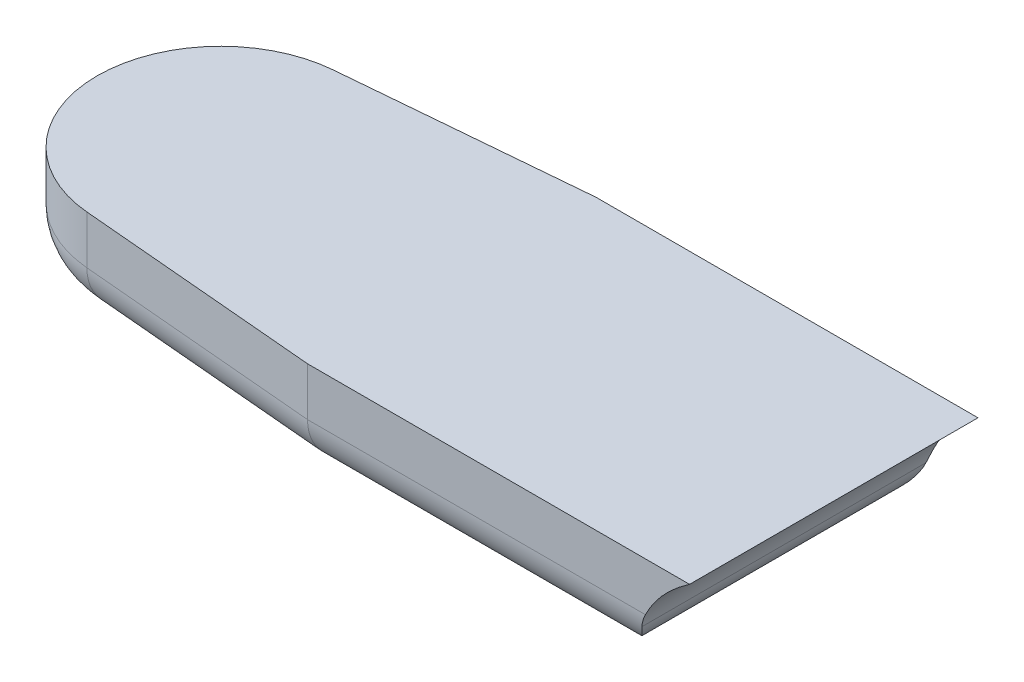
from build123d import *

# Parameters (mm, degrees)
EXTRUDE_1_DEPTH          = 20
CUT_EXTRUDE_1_DEPTH      = 168.622030081
CUT_EXTRUDE_1_DEPTH_BACK = 168.622030081
FILLET_1_R               = 10


with BuildPart() as part:
    # 草图3 → 凸台-拉伸1 (new body)
    with BuildSketch(Plane(origin=(0, 0, 0), x_dir=(1, 0, 0), z_dir=(0, 1, 0))):
        with BuildLine():
            Line((163.730296133, -29.825074964), (80.579718414, -29.825074964))
            Line((80.579718414, -29.825074964), (30.579718414, -25.450641788))
            ThreePointArc((30.579718414, -25.450641788), (7.258501946, 0), (30.579718414, 25.450641788))
            Line((30.579718414, 25.450641788), (80.579718414, 29.825074964))
            Line((80.579718414, 29.825074964), (163.730296133, 29.825074964))
            Line((163.730296133, 29.825074964), (163.730296133, -29.825074964))
        make_face()
    extrude(amount=-EXTRUDE_1_DEPTH)

    # 草图4 → 切除-拉伸1 (cut, two sides: drawn at the far end of the back side and taken through both)
    with BuildSketch(Plane.XY.offset(-CUT_EXTRUDE_1_DEPTH_BACK)):
        with BuildLine():
            Line((163.730296133, 0), (159.58071917, 0))
            add(Edge.make_bspline(
                [(159.58071917, 0), (148.122104631, -7.824360885), (148.302724928, -20)],
                knots=[0, 0, 0, 1, 1, 1], degree=2))
            Line((148.302724928, -20), (203.221653408, -20))
            Line((203.221653408, -20), (203.221653408, 0))
            Line((203.221653408, 0), (163.730296133, 0))
        make_face()
    extrude(amount=CUT_EXTRUDE_1_DEPTH + CUT_EXTRUDE_1_DEPTH_BACK, mode=Mode.SUBTRACT)

    # 圆角1
    # the kernel refuses this fillet: 10 mm, written as the material it takes off along each edge
    with BuildSketch(Plane(origin=(55.579718414, -20, -29.825074964), x_dir=(0, 0, 1), z_dir=(1, 0, 0))) as fillet_1_piece_1_section:
        with BuildLine():
            CenterArc((FILLET_1_R, -FILLET_1_R), FILLET_1_R, 90, 90)
            Line((0, -FILLET_1_R), (-FILLET_1_R * 0.02, -FILLET_1_R))
            Line((-FILLET_1_R * 0.02, -FILLET_1_R), (-FILLET_1_R * 0.02, FILLET_1_R * 0.02))
            Line((-FILLET_1_R * 0.02, FILLET_1_R * 0.02), (FILLET_1_R, FILLET_1_R * 0.02))
            Line((FILLET_1_R, FILLET_1_R * 0.02), (FILLET_1_R, 0))
        make_face()
    fillet_1_piece_1 = extrude(amount=117.723006514, mode=Mode.PRIVATE)
    fillet_1_piece_1 = split(fillet_1_piece_1, bisect_by=Plane(origin=(118.163125223, -17.857550266, -33.113196996), z_dir=(0.08715574274764791, 0, 0.9961946980917464)), keep=Keep.TOP, mode=Mode.PRIVATE)
    add(fillet_1_piece_1, mode=Mode.SUBTRACT)
    with BuildSketch(Plane(origin=(173.302724928, -20, 29.825074964), x_dir=(0, 1, 0), z_dir=(-1, 0, 0))) as fillet_1_piece_2_section:
        with BuildLine():
            CenterArc((FILLET_1_R, FILLET_1_R), FILLET_1_R, 180, 90)
            Line((0, FILLET_1_R), (-FILLET_1_R * 0.02, FILLET_1_R))
            Line((-FILLET_1_R * 0.02, FILLET_1_R), (-FILLET_1_R * 0.02, -FILLET_1_R * 0.02))
            Line((-FILLET_1_R * 0.02, -FILLET_1_R * 0.02), (FILLET_1_R, -FILLET_1_R * 0.02))
            Line((FILLET_1_R, -FILLET_1_R * 0.02), (FILLET_1_R, 0))
        make_face()
    fillet_1_piece_2 = extrude(amount=117.723006514, mode=Mode.PRIVATE)
    fillet_1_piece_2 = split(fillet_1_piece_2, bisect_by=Plane(origin=(118.163125223, -17.857550266, 33.113196996), z_dir=(0.08715574274764758, 0, -0.9961946980917465)), keep=Keep.TOP, mode=Mode.PRIVATE)
    add(fillet_1_piece_2, mode=Mode.SUBTRACT)
    with BuildSketch(Plane(origin=(105.484585867, -20, 32.003968533), x_dir=(0, 1, 0), z_dir=(-0.9961946980917465, 0, -0.08715574274764758))) as fillet_1_piece_3_section:
        with BuildLine():
            CenterArc((FILLET_1_R, FILLET_1_R), FILLET_1_R, 180, 90)
            Line((0, FILLET_1_R), (-FILLET_1_R * 0.02, FILLET_1_R))
            Line((-FILLET_1_R * 0.02, FILLET_1_R), (-FILLET_1_R * 0.02, -FILLET_1_R * 0.02))
            Line((-FILLET_1_R * 0.02, -FILLET_1_R * 0.02), (FILLET_1_R, -FILLET_1_R * 0.02))
            Line((FILLET_1_R, -FILLET_1_R * 0.02), (FILLET_1_R, 0))
        make_face()
    fillet_1_piece_3 = extrude(amount=75.190991877, mode=Mode.PRIVATE)
    fillet_1_piece_3 = split(fillet_1_piece_3, bisect_by=Plane(origin=(64.333848785, -17.936020538, 29.825074964), z_dir=(0, 0, -1)), keep=Keep.TOP, mode=Mode.PRIVATE)
    add(fillet_1_piece_3, mode=Mode.SUBTRACT)
    with BuildSketch(Plane(origin=(148.302724928, -20, 0), x_dir=(-1, 0, 0), z_dir=(0, 0, -1))) as fillet_1_piece_4:
        with BuildLine():
            CenterArc((8.573839583, 10), FILLET_1_R, 197.276402176, 72.723597824)
            Line((-0.974992369, 7.030183787), (-1.165969008, 6.970787462))
            ThreePointArc((-1.165969008, 6.970787462), (-0.405650645, 3.526203376), (-0.199977997, 0.002966586))
            Line((-0.199977997, 0.002966586), (0, -0.2))
            Line((0, -0.2), (8.573839583, -0.2))
            Line((8.573839583, -0.2), (8.573839583, 0))
        make_face()
    extrude(amount=29.825074964, mode=Mode.SUBTRACT)
    with BuildSketch(Plane(origin=(32.80636105, -20, 0), x_dir=(-0.08715574274764748, 0, 0.9961946980917464), z_dir=(0.9961946980917464, 0, 0.08715574274764748))) as fillet_1_piece_5:
        with BuildLine():
            CenterArc((25.547859105 - FILLET_1_R, -FILLET_1_R), FILLET_1_R, 0, 90)
            Line((25.547859105, -FILLET_1_R), (25.547859105 + FILLET_1_R * 0.02, -FILLET_1_R))
            Line((25.547859105 + FILLET_1_R * 0.02, -FILLET_1_R), (25.547859105 + FILLET_1_R * 0.02, FILLET_1_R * 0.02))
            Line((25.547859105 + FILLET_1_R * 0.02, FILLET_1_R * 0.02), (25.547859105 - FILLET_1_R, FILLET_1_R * 0.02))
            Line((25.547859105 - FILLET_1_R, FILLET_1_R * 0.02), (25.547859105 - FILLET_1_R, 0))
        make_face()
    revolve(axis=Axis((32.80636105, -20, 0), (0, -1, 0)), revolution_arc=170, mode=Mode.SUBTRACT)
    with BuildSketch(Plane(origin=(30.579718414, -20, -25.450641788), x_dir=(0.0871557427476479, 0, 0.9961946980917464), z_dir=(0.9961946980917464, 0, -0.08715574274764791))) as fillet_1_piece_6_section:
        with BuildLine():
            CenterArc((FILLET_1_R, -FILLET_1_R), FILLET_1_R, 90, 90)
            Line((0, -FILLET_1_R), (-FILLET_1_R * 0.02, -FILLET_1_R))
            Line((-FILLET_1_R * 0.02, -FILLET_1_R), (-FILLET_1_R * 0.02, FILLET_1_R * 0.02))
            Line((-FILLET_1_R * 0.02, FILLET_1_R * 0.02), (FILLET_1_R, FILLET_1_R * 0.02))
            Line((FILLET_1_R, FILLET_1_R * 0.02), (FILLET_1_R, 0))
        make_face()
    fillet_1_piece_6 = extrude(amount=75.190991877, mode=Mode.PRIVATE)
    fillet_1_piece_6 = split(fillet_1_piece_6, bisect_by=Plane(origin=(64.333848785, -17.936020538, -29.825074964), z_dir=(0, 0, 1)), keep=Keep.TOP, mode=Mode.PRIVATE)
    add(fillet_1_piece_6, mode=Mode.SUBTRACT)
    with BuildSketch(Plane(origin=(148.302724928, -20, 0), x_dir=(-1, 0, 0), z_dir=(0, 0, 1))) as fillet_1_piece_7:
        with BuildLine():
            CenterArc((8.573839583, -10), FILLET_1_R, 90, 72.723597824)
            Line((-0.974992369, -7.030183787), (-1.165969008, -6.970787462))
            ThreePointArc((-1.165969008, -6.970787462), (-0.405650645, -3.526203376), (-0.199977997, -0.002966586))
            Line((-0.199977997, -0.002966586), (0, 0.2))
            Line((0, 0.2), (8.573839583, 0.2))
            Line((8.573839583, 0.2), (8.573839583, 0))
        make_face()
    extrude(amount=29.825074964, mode=Mode.SUBTRACT)
    with BuildSketch(Plane(origin=(55.579718414, -20, -29.825074964), x_dir=(0, 0, 1), z_dir=(1, 0, 0))) as fillet_1_piece_8a_section:
        with BuildLine():
            CenterArc((FILLET_1_R, -FILLET_1_R), FILLET_1_R, 90, 90)
            Line((0, -FILLET_1_R), (-FILLET_1_R * 0.02, -FILLET_1_R))
            Line((-FILLET_1_R * 0.02, -FILLET_1_R), (-FILLET_1_R * 0.02, FILLET_1_R * 0.02))
            Line((-FILLET_1_R * 0.02, FILLET_1_R * 0.02), (FILLET_1_R, FILLET_1_R * 0.02))
            Line((FILLET_1_R, FILLET_1_R * 0.02), (FILLET_1_R, 0))
        make_face()
    fillet_1_piece_8a = extrude(amount=117.723006514, mode=Mode.PRIVATE)
    fillet_1_piece_8a = split(fillet_1_piece_8a, bisect_by=Plane(origin=(65.506587176, -16.325384108, -28.506346857), z_dir=(-0.08715574274764791, 0, -0.9961946980917464)), keep=Keep.TOP, mode=Mode.PRIVATE)
    with BuildSketch(Plane(origin=(30.579718414, -20, -25.450641788), x_dir=(0.0871557427476479, 0, 0.9961946980917464), z_dir=(0.9961946980917464, 0, -0.08715574274764791))) as fillet_1_piece_8b_section:
        with BuildLine():
            CenterArc((FILLET_1_R, -FILLET_1_R), FILLET_1_R, 90, 90)
            Line((0, -FILLET_1_R), (-FILLET_1_R * 0.02, -FILLET_1_R))
            Line((-FILLET_1_R * 0.02, -FILLET_1_R), (-FILLET_1_R * 0.02, FILLET_1_R * 0.02))
            Line((-FILLET_1_R * 0.02, FILLET_1_R * 0.02), (FILLET_1_R, FILLET_1_R * 0.02))
            Line((FILLET_1_R, FILLET_1_R * 0.02), (FILLET_1_R, 0))
        make_face()
    fillet_1_piece_8b = extrude(amount=75.190991877, mode=Mode.PRIVATE)
    fillet_1_piece_8b = split(fillet_1_piece_8b, bisect_by=Plane(origin=(95.710426565, -16.325384108, -29.825074964), z_dir=(0, 0, -1)), keep=Keep.TOP, mode=Mode.PRIVATE)
    fillet_1_piece_8 = fillet_1_piece_8a & fillet_1_piece_8b
    add(fillet_1_piece_8, mode=Mode.SUBTRACT)
    with BuildSketch(Plane(origin=(173.302724928, -20, 29.825074964), x_dir=(0, 1, 0), z_dir=(-1, 0, 0))) as fillet_1_piece_9a_section:
        with BuildLine():
            CenterArc((FILLET_1_R, FILLET_1_R), FILLET_1_R, 180, 90)
            Line((0, FILLET_1_R), (-FILLET_1_R * 0.02, FILLET_1_R))
            Line((-FILLET_1_R * 0.02, FILLET_1_R), (-FILLET_1_R * 0.02, -FILLET_1_R * 0.02))
            Line((-FILLET_1_R * 0.02, -FILLET_1_R * 0.02), (FILLET_1_R, -FILLET_1_R * 0.02))
            Line((FILLET_1_R, -FILLET_1_R * 0.02), (FILLET_1_R, 0))
        make_face()
    fillet_1_piece_9a = extrude(amount=117.723006514, mode=Mode.PRIVATE)
    fillet_1_piece_9a = split(fillet_1_piece_9a, bisect_by=Plane(origin=(65.506587176, -16.325384108, 28.506346857), z_dir=(-0.08715574274764758, 0, 0.9961946980917465)), keep=Keep.TOP, mode=Mode.PRIVATE)
    with BuildSketch(Plane(origin=(105.484585867, -20, 32.003968533), x_dir=(0, 1, 0), z_dir=(-0.9961946980917465, 0, -0.08715574274764758))) as fillet_1_piece_9b_section:
        with BuildLine():
            CenterArc((FILLET_1_R, FILLET_1_R), FILLET_1_R, 180, 90)
            Line((0, FILLET_1_R), (-FILLET_1_R * 0.02, FILLET_1_R))
            Line((-FILLET_1_R * 0.02, FILLET_1_R), (-FILLET_1_R * 0.02, -FILLET_1_R * 0.02))
            Line((-FILLET_1_R * 0.02, -FILLET_1_R * 0.02), (FILLET_1_R, -FILLET_1_R * 0.02))
            Line((FILLET_1_R, -FILLET_1_R * 0.02), (FILLET_1_R, 0))
        make_face()
    fillet_1_piece_9b = extrude(amount=75.190991877, mode=Mode.PRIVATE)
    fillet_1_piece_9b = split(fillet_1_piece_9b, bisect_by=Plane(origin=(95.710426565, -16.325384108, 29.825074964), z_dir=(0, 0, 1)), keep=Keep.TOP, mode=Mode.PRIVATE)
    fillet_1_piece_9 = fillet_1_piece_9a & fillet_1_piece_9b
    add(fillet_1_piece_9, mode=Mode.SUBTRACT)


solid = part.part
